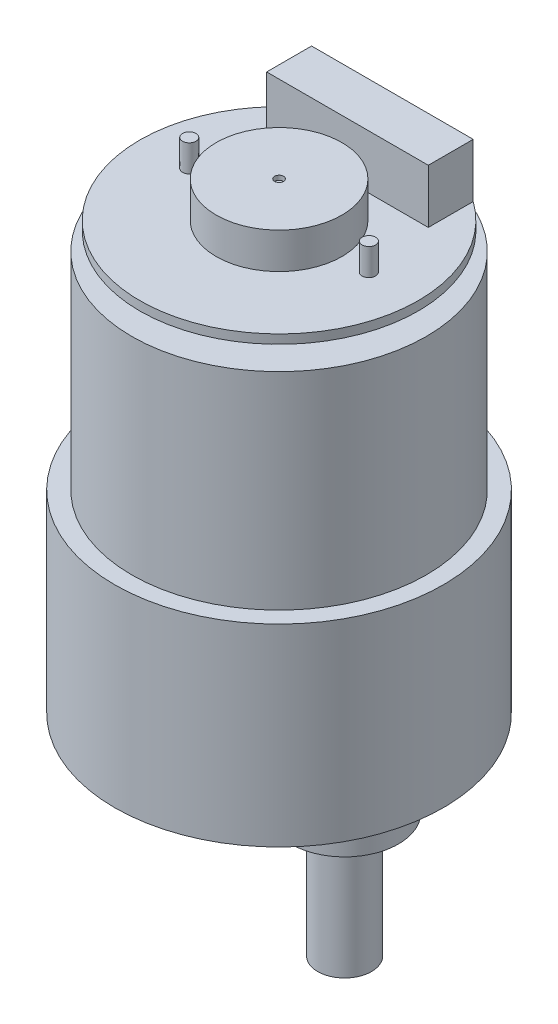
from build123d import *

# Parameters (mm, degrees)
SKETCH_1_R                 = 18.3
SKETCH_1_R_2               = 13
SKETCH_1_R_3               = 6
SKETCH_1_R_4               = 1.5
SKETCH_1_R_5               = 3
EXTRUDE_2_DEPTH            = 21.5
CUT_EXTRUDE_8_DEPTH        = 1
SKETCH_1_10_R              = 1.5
CUT_EXTRUDE_9_DEPTH        = 5
EXTRUDE_START              = -6
SKETCH_1_11_R              = 6
SKETCH_1_11_R_2            = 3
EXTRUDE_3_DEPTH            = 6
EXTRUDE_START_2            = -19.8
SKETCH_1_12_R              = 3
EXTRUDE_4_DEPTH            = 19.8
CUT_EXTRUDE_10_DEPTH       = 11.5
SKETCH_4_R                 = 16.4
EXTRUDE_5_DEPTH            = 23
SKETCH_5_R                 = 0.75
EXTRUDE_6_DEPTH            = 6
SKETCH_5_3_R               = 15.5
SKETCH_5_3_R_2             = 0.75
SKETCH_5_3_R_3             = 3.5
EXTRUDE_7_DEPTH            = 3
CUT_EXTRUDE_11_OUTLINE_R   = 15.5
CUT_EXTRUDE_11_OUTLINE_R_2 = 0.75
CUT_EXTRUDE_11_OUTLINE_R_3 = 3.5
CUT_EXTRUDE_11_DEPTH       = 2
SKETCH_6_R                 = 7
EXTRUDE_8_DEPTH            = 4
SKETCH_6_3_W               = 16
SKETCH_6_3_H               = 4
EXTRUDE_9_DEPTH            = 6
SKETCH_7_R                 = 0.5
CUT_EXTRUDE_12_DEPTH       = 0.5
SKETCH_8_W                 = 16.4
SKETCH_8_H                 = 4.4
CUT_EXTRUDE_13_DEPTH       = 4.5
SKETCH_9_R                 = 0.4
EXTRUDE_10_DEPTH           = 4


# Read off the part's stored shape, not the designer's step: 切除-拉伸11
with BuildPart() as part:
    # 草图1 → 凸台-拉伸2 (new body)
    # profile 1 of 15: a face of its own
    with BuildSketch(Plane(origin=(0, 0, 0), x_dir=(1, 0, 0), z_dir=(0, 1, 0))):
        with Locations(Location((0, 0, 0), (0, 0, 270))):
            Circle(SKETCH_1_R)
        Circle(SKETCH_1_R_2, mode=Mode.SUBTRACT)
        with Locations((7.3, 0)):
            Circle(SKETCH_1_R_3, mode=Mode.SUBTRACT)
        with Locations((-13.423393759, 7.75)):
            Circle(SKETCH_1_R_4, mode=Mode.SUBTRACT)
        with Locations((-13.423393759, -7.75)):
            Circle(SKETCH_1_R_4, mode=Mode.SUBTRACT)
        with Locations((0, -15.5)):
            Circle(SKETCH_1_R_4, mode=Mode.SUBTRACT)
        with Locations((13.423393759, -7.75)):
            Circle(SKETCH_1_R_4, mode=Mode.SUBTRACT)
        with Locations((13.423393759, 7.75)):
            Circle(SKETCH_1_R_4, mode=Mode.SUBTRACT)
        with Locations((0, 15.5)):
            Circle(SKETCH_1_R_4, mode=Mode.SUBTRACT)
    # profile 2 of 15: a face of its own
    with BuildSketch(Plane(origin=(0, 0, 0), x_dir=(1, 0, 0), z_dir=(0, 1, 0))):
        Circle(SKETCH_1_R_2)
    # profile 3 of 15: a face of its own
    with BuildSketch(Plane(origin=(0, 0, 0), x_dir=(1, 0, 0), z_dir=(0, 1, 0))):
        with Locations((7.3, 0)):
            Circle(SKETCH_1_R_3)
    # profile 4 of 15: a face of its own
    with BuildSketch(Plane(origin=(0, 0, 0), x_dir=(1, 0, 0), z_dir=(0, 1, 0))):
        with Locations((0, 15.5)):
            Circle(SKETCH_1_R_4)
    # profile 5 of 15: a face of its own
    with BuildSketch(Plane(origin=(0, 0, 0), x_dir=(1, 0, 0), z_dir=(0, 1, 0))):
        with Locations((-13.423393759, 7.75)):
            Circle(SKETCH_1_R_4)
    # profile 6 of 15: a face of its own
    with BuildSketch(Plane(origin=(0, 0, 0), x_dir=(1, 0, 0), z_dir=(0, 1, 0))):
        with Locations((-13.423393759, -7.75)):
            Circle(SKETCH_1_R_4)
    # profile 7 of 15: a face of its own
    with BuildSketch(Plane(origin=(0, 0, 0), x_dir=(1, 0, 0), z_dir=(0, 1, 0))):
        with Locations((0, -15.5)):
            Circle(SKETCH_1_R_4)
    # profile 8 of 15: a face of its own
    with BuildSketch(Plane(origin=(0, 0, 0), x_dir=(1, 0, 0), z_dir=(0, 1, 0))):
        with Locations((13.423393759, -7.75)):
            Circle(SKETCH_1_R_4)
    # profile 9 of 15: a face of its own
    with BuildSketch(Plane(origin=(0, 0, 0), x_dir=(1, 0, 0), z_dir=(0, 1, 0))):
        with Locations((13.423393759, 7.75)):
            Circle(SKETCH_1_R_4)
    # profile 10 of 15: a face of its own
    with BuildSketch(Plane(origin=(0, 0, 0), x_dir=(1, 0, 0), z_dir=(0, 1, 0))):
        with Locations((7.3, 0)):
            Circle(SKETCH_1_R_5)
    # profile 11 of 15: a face of its own
    with BuildSketch(Plane(origin=(0, 0, 0), x_dir=(1, 0, 0), z_dir=(0, 1, 0))):
        with Locations((7.3, 0)):
            Circle(SKETCH_1_R_3)
    # profile 12 of 15: a face of its own
    with BuildSketch(Plane(origin=(0, 0, 0), x_dir=(1, 0, 0), z_dir=(0, 1, 0))):
        Circle(SKETCH_1_R_2)
    # profile 13 of 15: a face of its own
    with BuildSketch(Plane(origin=(0, 0, 0), x_dir=(1, 0, 0), z_dir=(0, 1, 0))):
        with Locations((7.3, 0)):
            Circle(SKETCH_1_R_5)
    # profile 14 of 15: a face of its own
    with BuildSketch(Plane(origin=(0, 0, 0), x_dir=(1, 0, 0), z_dir=(0, 1, 0))):
        Circle(SKETCH_1_R_2)
    # profile 15 of 15: a face of its own
    with BuildSketch(Plane(origin=(0, 0, 0), x_dir=(1, 0, 0), z_dir=(0, 1, 0))):
        with Locations((7.3, 0)):
            Circle(SKETCH_1_R_3)
    extrude(amount=EXTRUDE_2_DEPTH)

    # 草图1<9> → 切除-拉伸8 (cut)
    with BuildSketch(Plane(origin=(0, 0, 0), x_dir=(1, 0, 0), z_dir=(0, 1, 0))):
        with BuildLine():
            ThreePointArc((12.759589041, -2.488551286), (1.3, 0), (12.759589041, 2.488551286))
            ThreePointArc((12.759589041, 2.488551286), (-13, 0), (12.759589041, -2.488551286))
        make_face()
    extrude(amount=CUT_EXTRUDE_8_DEPTH, mode=Mode.SUBTRACT)

    # 草图1<10> → 切除-拉伸9 (cut)
    with BuildSketch(Plane(origin=(0, 0, 0), x_dir=(1, 0, 0), z_dir=(0, 1, 0))):
        with Locations(Location((13.423393759, 7.75, 0), (0, 0, 270))):
            Circle(SKETCH_1_10_R)
        with Locations(Location((0, 15.5, 0), (0, 0, 270))):
            Circle(SKETCH_1_10_R)
        with Locations(Location((-13.423393759, 7.75, 0), (0, 0, 270))):
            Circle(SKETCH_1_10_R)
        with Locations(Location((-13.423393759, -7.75, 0), (0, 0, 270))):
            Circle(SKETCH_1_10_R)
        with Locations(Location((0, -15.5, 0), (0, 0, 270))):
            Circle(SKETCH_1_10_R)
        with Locations(Location((13.423393759, -7.75, 0), (0, 0, 270))):
            Circle(SKETCH_1_10_R)
    extrude(amount=CUT_EXTRUDE_9_DEPTH, mode=Mode.SUBTRACT)

    # 草图1<11> → 凸台-拉伸3 (add)
    with BuildSketch(Plane(origin=(0, 0, 0), x_dir=(1, 0, 0), z_dir=(0, 1, 0)).offset(EXTRUDE_START)):
        with Locations(Location((7.3, 0, 0), (0, 0, 24.504112001))):
            Circle(SKETCH_1_11_R)
        with Locations(Location((7.3, 0, 0), (0, 0, 270))):
            Circle(SKETCH_1_11_R_2, mode=Mode.SUBTRACT)
    extrude(amount=EXTRUDE_3_DEPTH)

    # 草图1<12> → 凸台-拉伸4 (add)
    with BuildSketch(Plane(origin=(0, 0, 0), x_dir=(1, 0, 0), z_dir=(0, 1, 0)).offset(EXTRUDE_START_2)):
        with Locations(Location((7.3, 0, 0), (0, 0, 270))):
            Circle(SKETCH_1_12_R)
    extrude(amount=EXTRUDE_4_DEPTH)

    # 草图3 → 切除-拉伸10 (cut)
    with BuildSketch(Plane.XZ.offset(19.8)):
        with BuildLine():
            Line((4.8, -1.658312395), (4.8, 1.658312395))
            ThreePointArc((4.8, 1.658312395), (4.3, 0), (4.8, -1.658312395))
        make_face()
    extrude(amount=-CUT_EXTRUDE_10_DEPTH, mode=Mode.SUBTRACT)

    # 草图4 → 凸台-拉伸5 (add)
    with BuildSketch(Plane(origin=(0, 21.5, 0), x_dir=(1, 0, 0), z_dir=(0, 1, 0))):
        with Locations(Location((0, 0, 0), (0, 0, 270))):
            Circle(SKETCH_4_R)
    extrude(amount=EXTRUDE_5_DEPTH)

    # 草图5 → 凸台-拉伸6 (add)
    with BuildSketch(Plane(origin=(0, 44.5, 0), x_dir=(1, 0, 0), z_dir=(0, 1, 0))):
        with Locations(Location((-10, 0, 0), (0, 0, 270))):
            Circle(SKETCH_5_R)
        with Locations(Location((10, 0, 0), (0, 0, 90))):
            Circle(SKETCH_5_R)
    extrude(amount=EXTRUDE_6_DEPTH)

    # 草图5<3> → 凸台-拉伸7 (add)
    # profile 1 of 2: a face of its own
    with BuildSketch(Plane(origin=(0, 44.5, 0), x_dir=(1, 0, 0), z_dir=(0, 1, 0))):
        with Locations(Location((0, 0, 0), (0, 0, 270))):
            Circle(SKETCH_5_3_R)
        with Locations(Location((10, 0, 0), (0, 0, 90))):
            Circle(SKETCH_5_3_R_2, mode=Mode.SUBTRACT)
        Circle(SKETCH_5_3_R_3, mode=Mode.SUBTRACT)
        with Locations(Location((-10, 0, 0), (0, 0, 270))):
            Circle(SKETCH_5_3_R_2, mode=Mode.SUBTRACT)
    # profile 2 of 2: a face of its own
    with BuildSketch(Plane(origin=(0, 44.5, 0), x_dir=(1, 0, 0), z_dir=(0, 1, 0))):
        Circle(SKETCH_5_3_R_3)
    extrude(amount=EXTRUDE_7_DEPTH)

    # 切除-拉伸11 outline → 切除-拉伸11 (cut)
    with BuildSketch(Plane(origin=(0, 44.5, 0), x_dir=(1, 0, 0), z_dir=(0, 1, 0))):
        Circle(CUT_EXTRUDE_11_OUTLINE_R)
        with Locations((-10, 0)):
            Circle(CUT_EXTRUDE_11_OUTLINE_R_2, mode=Mode.SUBTRACT)
        Circle(CUT_EXTRUDE_11_OUTLINE_R_3, mode=Mode.SUBTRACT)
        with Locations((10, 0)):
            Circle(CUT_EXTRUDE_11_OUTLINE_R_2, mode=Mode.SUBTRACT)
    extrude(amount=CUT_EXTRUDE_11_DEPTH, mode=Mode.SUBTRACT)

    # 草图6 → 凸台-拉伸8 (add)
    with BuildSketch(Plane(origin=(0, 47.5, 0), x_dir=(1, 0, 0), z_dir=(0, 1, 0))):
        with Locations(Location((0, 0, 0), (0, 0, 270))):
            Circle(SKETCH_6_R)
    extrude(amount=EXTRUDE_8_DEPTH)

    # 草图6<3> → 凸台-拉伸9 (add)
    with BuildSketch(Plane(origin=(0, 47.5, 0), x_dir=(1, 0, 0), z_dir=(0, 1, 0))):
        with Locations((0, 10.619429464)):
            Rectangle(SKETCH_6_3_W, SKETCH_6_3_H)
        Polygon((-8, 12.619429464), (-9, 12.619429464), (-9, 7.619429464), (9, 7.619429464), (9, 12.619429464), (8, 12.619429464), (8, 8.619429464), (-8, 8.619429464), align=None)
    extrude(amount=EXTRUDE_9_DEPTH)

    # 草图7 → 切除-拉伸12 (cut)
    with BuildSketch(Plane(origin=(0, 51.5, 0), x_dir=(1, 0, 0), z_dir=(0, 1, 0))):
        with Locations(Location((0, 0, 0), (0, 0, 270))):
            Circle(SKETCH_7_R)
    extrude(amount=-CUT_EXTRUDE_12_DEPTH, mode=Mode.SUBTRACT)

    # 草图8 → 切除-拉伸13 (cut)
    with BuildSketch(Plane(origin=(0, 0, -12.619429464), x_dir=(-1, 0, 0), z_dir=(0, 0, -1))):
        with Locations((0, 50.5)):
            Rectangle(SKETCH_8_W, SKETCH_8_H)
    extrude(amount=-CUT_EXTRUDE_13_DEPTH, mode=Mode.SUBTRACT)

    # 草图9 → 凸台-拉伸10 (add)
    with BuildSketch(Plane(origin=(0, 0, -8.119429464), x_dir=(-1, 0, 0), z_dir=(0, 0, -1))):
        with Locations((-6.35, 50.5)):
            Circle(SKETCH_9_R)
        with Locations((-3.81, 50.5)):
            Circle(SKETCH_9_R)
        with Locations((-1.27, 50.5)):
            Circle(SKETCH_9_R)
        with Locations((1.27, 50.5)):
            Circle(SKETCH_9_R)
        with Locations((3.81, 50.5)):
            Circle(SKETCH_9_R)
        with Locations((6.35, 50.5)):
            Circle(SKETCH_9_R)
    extrude(amount=EXTRUDE_10_DEPTH)


solid = part.part
